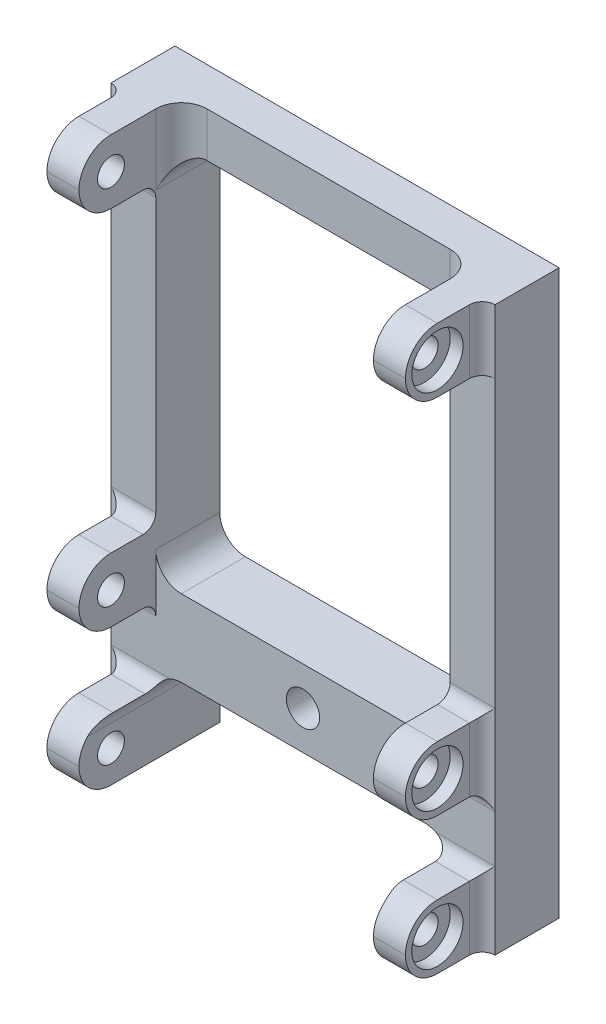
from build123d import *

# Parameters (mm, degrees)
SKETCH2_W             = 3.5
SKETCH2_H             = 44
BOSS_EXTRUDE1_DEPTH   = 5
BOSS_EXTRUDE1_2_DEPTH = 5
SKETCH3_W             = 30
SKETCH3_H             = 3.5
BOSS_EXTRUDE2_DEPTH   = 3
SKETCH4_W             = 2.5
SKETCH4_H             = 5
BOSS_EXTRUDE3_DEPTH   = 6
SKETCH5_R             = 1.05
CUT_EXTRUDE1_DEPTH    = 39.026306684
FILLET1_R             = 2.5
FILLET2_R             = 2
SKETCH6_W             = 23
SKETCH6_H             = 6
SKETCH6_R             = 1.3
BOSS_EXTRUDE4_DEPTH   = 5
FILLET3_R             = 2
SKETCH7_R             = 2
CUT_EXTRUDE2_DEPTH    = 1
FILLET4_R             = 1


with BuildPart() as part:
    # Sketch2 → Boss-Extrude1 (new body)
    with BuildSketch(Plane.XY):
        with Locations((-13.25, 0)):
            Rectangle(SKETCH2_W, SKETCH2_H)
    extrude(amount=BOSS_EXTRUDE1_DEPTH)



with BuildPart() as body_2:
    # Sketch2 → Boss-Extrude1 2 (new body)
    with BuildSketch(Plane.XY):
        with Locations((13.25, 0)):
            Rectangle(SKETCH2_W, SKETCH2_H)
    extrude(amount=BOSS_EXTRUDE1_2_DEPTH)


with BuildPart() as part_1:
    add(part.part)

    add(body_2.part)  # Boss-Extrude2 merges body 2
    # Sketch3 → Boss-Extrude2 (add)
    with BuildSketch(Plane(origin=(0, 0, 0), x_dir=(-1, 0, 0), z_dir=(0, 0, -1))):
        with Locations((0, 20.25)):
            Rectangle(SKETCH3_W, SKETCH3_H)
    extrude(amount=-BOSS_EXTRUDE2_DEPTH)

    # Sketch4 → Boss-Extrude3 (add)
    with BuildSketch(Plane.XY.offset(5)):
        with Locations((-12.75, 19.5)):
            Rectangle(SKETCH4_W, SKETCH4_H)
        with Locations((-12.75, -8.8)):
            Rectangle(SKETCH4_W, SKETCH4_H)
        with Locations((-12.75, -19.5)):
            Rectangle(SKETCH4_W, SKETCH4_H)
        with Locations((12.75, -19.5)):
            Rectangle(SKETCH4_W, SKETCH4_H)
        with Locations((12.75, -8.8)):
            Rectangle(SKETCH4_W, SKETCH4_H)
        with Locations((12.75, 19.5)):
            Rectangle(SKETCH4_W, SKETCH4_H)
    extrude(amount=BOSS_EXTRUDE3_DEPTH)

    # Sketch5 → Cut-Extrude1 (cut, through all)
    with BuildSketch(Plane.ZY.offset(14)):
        with Locations((8.5, 19.5)):
            Circle(SKETCH5_R)
        with Locations((8.5, -8.8)):
            Circle(SKETCH5_R)
        with Locations((8.5, -19.5)):
            Circle(SKETCH5_R)
    extrude(amount=-CUT_EXTRUDE1_DEPTH, mode=Mode.SUBTRACT)

    # Fillet1
    fillet1_edges = [part_1.edges().sort_by_distance(p)[0] for p in [
        (12.75, -17, 11),
        (12.75, -22, 11),
        (12.75, -6.3, 11),
        (12.75, -11.3, 11),
        (-12.75, -22, 11),
        (-12.75, -17, 11),
        (-12.75, -11.3, 11),
        (-12.75, -6.3, 11),
        (-12.75, 17, 11),
        (-12.75, 22, 11),
        (12.75, 22, 11),
        (12.75, 17, 11),
    ]]
    fillet(fillet1_edges, radius=FILLET1_R - 0.0001)  # a hair under: the kernel refuses the full size

    # Fillet2
    fillet2_edges = [part_1.edges().sort_by_distance(p)[0] for p in [
        (-11.5, 20.25, 3),
        (-11.5, 18.5, 1.5),
        (11.5, 18.5, 1.5),
        (11.5, 20.25, 3),
    ]]
    fillet(fillet2_edges, radius=FILLET2_R - 0.0001)  # a hair under: the kernel refuses the full size

    # Sketch6 → Boss-Extrude4 (add)
    with BuildSketch(Plane(origin=(0, 0, 0), x_dir=(-1, 0, 0), z_dir=(0, 0, -1))):
        with Locations((0, -12.8)):
            Rectangle(SKETCH6_W, SKETCH6_H)
        with Locations((0, -12.8)):
            Circle(SKETCH6_R, mode=Mode.SUBTRACT)
    extrude(amount=-BOSS_EXTRUDE4_DEPTH)

    # Fillet3
    fillet3_edges = [part_1.edges().sort_by_distance(p)[0] for p in [
        (-11.5, -9.8, 2.5),
        (-11.5, -15.8, 2.5),
        (11.5, -15.8, 2.5),
        (11.5, -9.8, 2.5),
    ]]
    fillet(fillet3_edges, radius=FILLET3_R)

    # Sketch7 → Cut-Extrude2 (cut)
    with BuildSketch(Plane.ZY.offset(14)):
        with Locations((8.5, 19.5)):
            Circle(SKETCH7_R)
        with Locations((8.5, -8.8)):
            Circle(SKETCH7_R)
        with Locations((8.5, -19.5)):
            Circle(SKETCH7_R)
    cut_extrude2 = extrude(amount=-CUT_EXTRUDE2_DEPTH, mode=Mode.SUBTRACT)

    # Mirror1: Cut-Extrude2 across plane
    add(cut_extrude2.mirror(Plane(origin=(0, 0, 0), x_dir=(0, 0, 1), z_dir=(1, 0, 0))), mode=Mode.SUBTRACT)

    # Fillet4
    fillet4_edges = [part_1.edges().sort_by_distance(p)[0] for p in [
        (12.75, -11.3, 5),
        (-12.75, -11.3, 5),
        (-12.75, 17, 5),
        (14, -19.5, 5),
        (14, -8.8, 5),
        (14, 19.5, 5),
        (-12.75, -6.3, 5),
        (-12.666515139, -17, 5),
        (-14, -19.5, 5),
        (-14, -8.8, 5),
        (12.666515139, -17, 5),
        (12.75, -6.3, 5),
        (-14, 19.5, 5),
    ]]
    fillet(fillet4_edges, radius=FILLET4_R - 0.0001)  # a hair under: the kernel refuses the full size


solid = part_1.part
